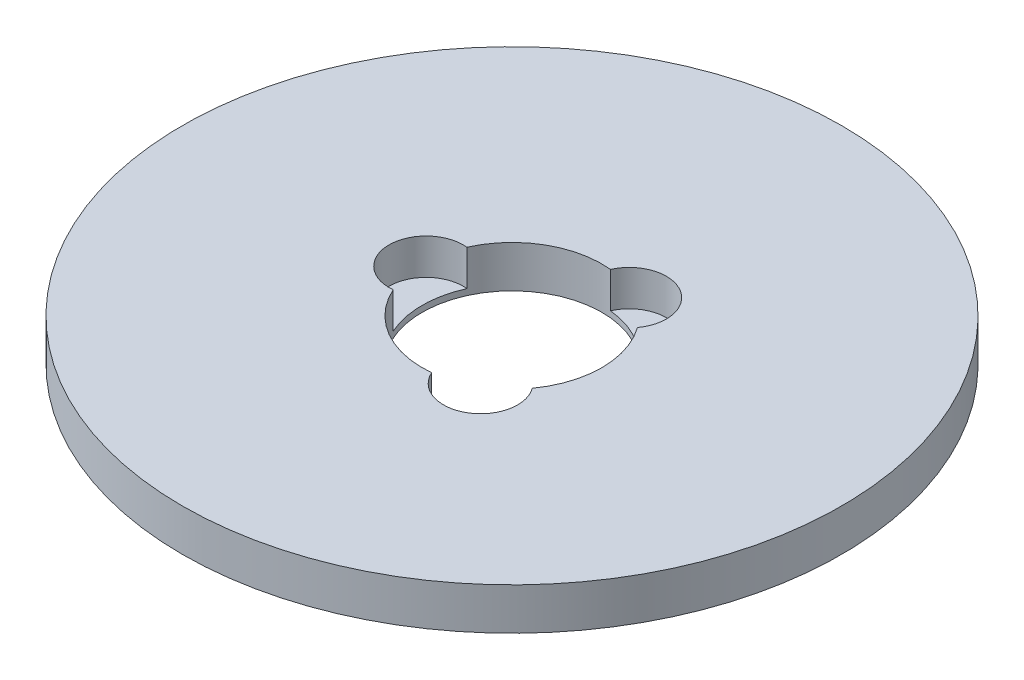
from build123d import *

# Parameters (mm, degrees)
SKETCH1_R           = 55
BOSS_EXTRUDE1_DEPTH = 7
SKETCH2_R           = 15
CUT_EXTRUDE1_DEPTH  = 79.096094653
SKETCH3_R           = 6.183228465
CUT_EXTRUDE2_DEPTH  = 5.983564939
CIRPATTERN1_COUNT   = 3


with BuildPart() as part:
    # Sketch1 → Boss-Extrude1 (new body)
    with BuildSketch(Plane(origin=(0, 0, 0), x_dir=(1, 0, 0), z_dir=(0, 1, 0))):
        Circle(SKETCH1_R)
    extrude(amount=BOSS_EXTRUDE1_DEPTH)

    # Sketch2 → Cut-Extrude1 (cut, through all)
    with BuildSketch(Plane(origin=(0, 0, 0), x_dir=(1, 0, 0), z_dir=(0, 1, 0))):
        Circle(SKETCH2_R)
    extrude(amount=CUT_EXTRUDE1_DEPTH, mode=Mode.SUBTRACT)

    # Sketch3 → Cut-Extrude2 (cut)
    with BuildSketch(Plane(origin=(0, 7, 0), x_dir=(1, 0, 0), z_dir=(0, 1, 0))):
        with Locations((-14.331761049, 0)):
            Circle(SKETCH3_R)
    cut_extrude2 = extrude(amount=-CUT_EXTRUDE2_DEPTH, mode=Mode.SUBTRACT)

    # CirPattern1: Cut-Extrude2 ×3 about axis
    cirpattern1_axis = Axis((0, 0, 0), (0, 1, 0))
    for i in range(1, CIRPATTERN1_COUNT):
        add(cut_extrude2.rotate(cirpattern1_axis, i * 360 / CIRPATTERN1_COUNT), mode=Mode.SUBTRACT)


solid = part.part
